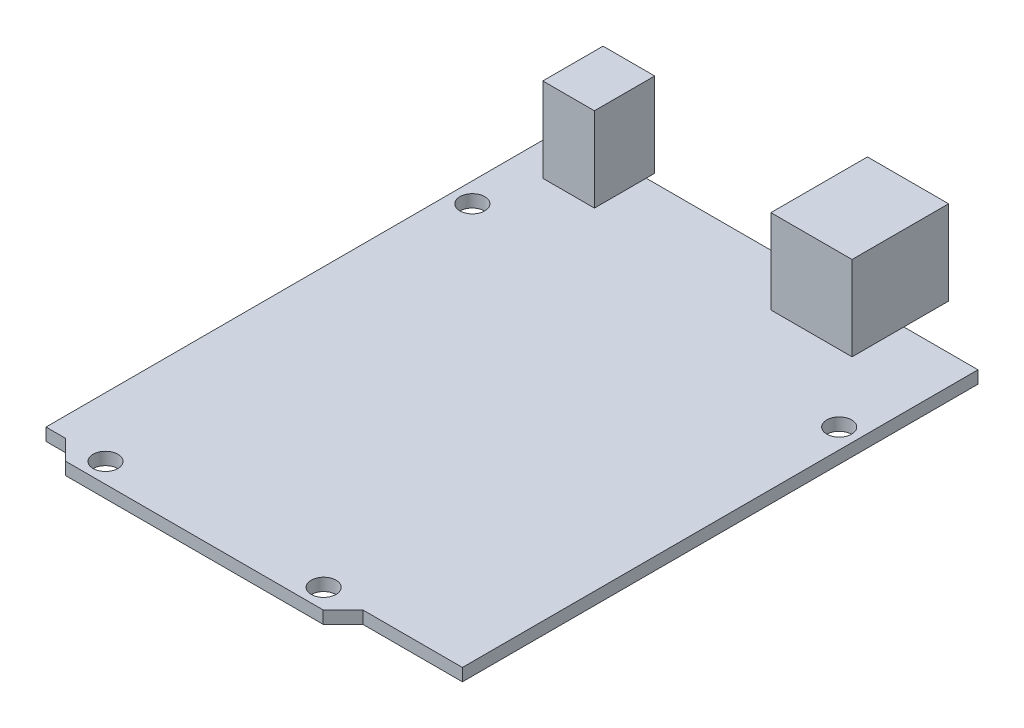
from build123d import *

# Parameters (mm, degrees)
BOSS_EXTRUDE1_DEPTH = 1.6
SKETCH2_W           = 6.615656004
SKETCH2_H           = 7.718265338
SKETCH2_W_2         = 10.396030864
SKETCH2_H_2         = 12.364976103
BOSS_EXTRUDE2_DEPTH = 10.8
SKETCH3_R           = 1.5875
CUT_EXTRUDE1_DEPTH  = 93.109064454


with BuildPart() as part:
    # Sketch1 → Boss-Extrude1 (new body)
    with BuildSketch(Plane(origin=(0, 0, 0), x_dir=(1, 0, 0), z_dir=(0, 1, 0))):
        Polygon((0, 68.58), (0, 2.54), (2.5, 2.54), (5.04, 0), (38.04, 0), (40.58, 2.54), (53.34, 2.54), (53.34, 68.58), align=None)
    extrude(amount=BOSS_EXTRUDE1_DEPTH)

    # Sketch2 → Boss-Extrude2 (add)
    with BuildSketch(Plane(origin=(0, 1.6, 0), x_dir=(1, 0, 0), z_dir=(0, 1, 0))):
        with Locations((7.533094465, 65.806229304)):
            Rectangle(SKETCH2_W, SKETCH2_H)
        with Locations((38.642429245, 68.129584686)):
            Rectangle(SKETCH2_W_2, SKETCH2_H_2)
    extrude(amount=BOSS_EXTRUDE2_DEPTH)

    # Sketch3 → Cut-Extrude1 (cut, through all)
    with BuildSketch(Plane(origin=(0, 1.6, 0), x_dir=(1, 0, 0), z_dir=(0, 1, 0))):
        with Locations((7.62, 2.54)):
            Circle(SKETCH3_R)
        with Locations((35.56, 2.54)):
            Circle(SKETCH3_R)
        with Locations((50.8, 53.34)):
            Circle(SKETCH3_R)
        with Locations((2.54, 54.61)):
            Circle(SKETCH3_R)
    extrude(amount=-CUT_EXTRUDE1_DEPTH, mode=Mode.SUBTRACT)


solid = part.part
